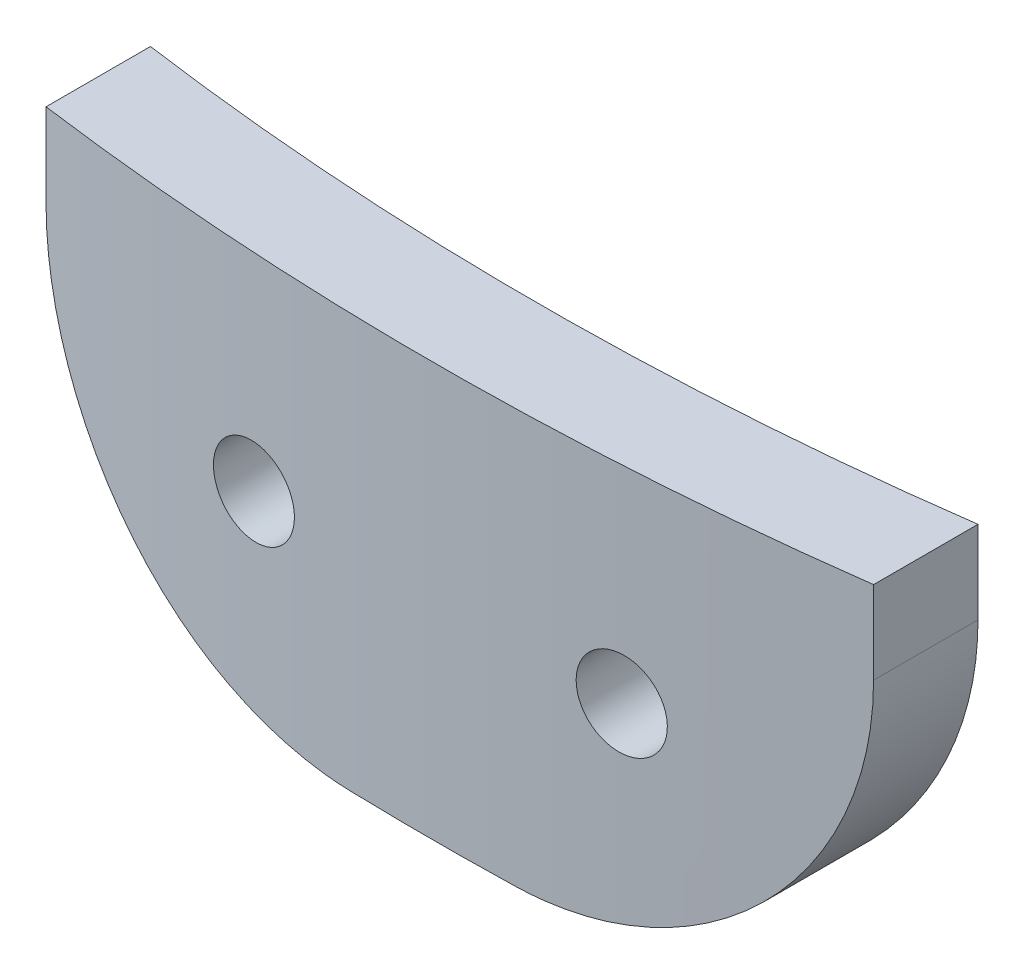
from build123d import *

# Parameters (mm, degrees)
BOSS_EXTRUDE1_DEPTH     = 12.7
CUT_EXTRUDE1_REACH      = 98.929
CUT_EXTRUDE1_END_RADIUS = 95.25
SKETCH2_R               = 1.3208
CUT_EXTRUDE2_REACH      = 98.929
CUT_EXTRUDE2_END_RADIUS = 95.25


with BuildPart() as part:
    # Sketch1 → Boss-Extrude1 (new body)
    with BuildSketch(Plane(origin=(0, 0, 0), x_dir=(1, 0, 0), z_dir=(0, 1, 0))):
        with BuildLine():
            ThreePointArc((12.7, -91.194932014), (0, -92.075), (-12.7, -91.194932014))
            Line((-12.7, -91.194932014), (-12.7, -94.399536545))
            ThreePointArc((-12.7, -94.399536545), (0, -95.25), (12.7, -94.399536545))
            Line((12.7, -94.399536545), (12.7, -91.194932014))
        make_face()
    extrude(amount=BOSS_EXTRUDE1_DEPTH)

    # Cut-Extrude1: up to this cylinder (the profile starts inside it)
    cut_extrude1_end = Plane(origin=(0, 6.35, 0), z_dir=(0, -1, 0)) * Cylinder(CUT_EXTRUDE1_END_RADIUS, 389.358, mode=Mode.PRIVATE)
    # Sketch2 → Cut-Extrude1 (cut, up to the surface)
    with BuildSketch(Plane.XY, mode=Mode.PRIVATE) as cut_extrude1_sk1:
        with Locations((-5.644444444, 6.35)):
            Circle(SKETCH2_R)
    cut_extrude1_tool1 = extrude(cut_extrude1_sk1.sketch, amount=CUT_EXTRUDE1_REACH, mode=Mode.PRIVATE) & cut_extrude1_end
    cut_extrude1 = cut_extrude1_tool1.solids().sort_by_distance((-5.644444, 6.35, 0))[0]
    add(cut_extrude1, mode=Mode.SUBTRACT)

    # Mirror1: Cut-Extrude1 across plane
    add(cut_extrude1.mirror(Plane(origin=(0, 0, 0), x_dir=(0, 0, 1), z_dir=(1, 0, 0))), mode=Mode.SUBTRACT)

    # Cut-Extrude2: up to this cylinder (the profile starts inside it)
    cut_extrude2_end = Plane(origin=(0, 2.269418, 0), z_dir=(0, -1, 0)) * Cylinder(CUT_EXTRUDE2_END_RADIUS, 389.358, mode=Mode.PRIVATE)
    # Sketch3 → Cut-Extrude2 (cut, up to the surface)
    with BuildSketch(Plane.XY, mode=Mode.PRIVATE) as cut_extrude2_sk1:
        with BuildLine():
            ThreePointArc((-2.54, 0), (-9.724204897, 2.975795103), (-12.7, 10.16))
            Line((-12.7, 10.16), (-12.7, 0))
            Line((-12.7, 0), (-2.54, 0))
        make_face()
    cut_extrude2_tool1 = extrude(cut_extrude2_sk1.sketch, amount=CUT_EXTRUDE2_REACH, mode=Mode.PRIVATE) & cut_extrude2_end
    add(cut_extrude2_tool1.solids().sort_by_distance((-10.430582, 2.269418, 0))[0], mode=Mode.SUBTRACT)
    # Sketch3 → Cut-Extrude2 (cut, up to the surface)
    with BuildSketch(Plane.XY, mode=Mode.PRIVATE) as cut_extrude2_sk2:
        with BuildLine():
            Line((12.7, 0), (12.7, 10.16))
            ThreePointArc((12.7, 10.16), (9.724204897, 2.975795103), (2.54, 0))
            Line((2.54, 0), (12.7, 0))
        make_face()
    cut_extrude2_tool2 = extrude(cut_extrude2_sk2.sketch, amount=CUT_EXTRUDE2_REACH, mode=Mode.PRIVATE) & cut_extrude2_end
    add(cut_extrude2_tool2.solids().sort_by_distance((10.430582, 2.269418, 0))[0], mode=Mode.SUBTRACT)


solid = part.part
